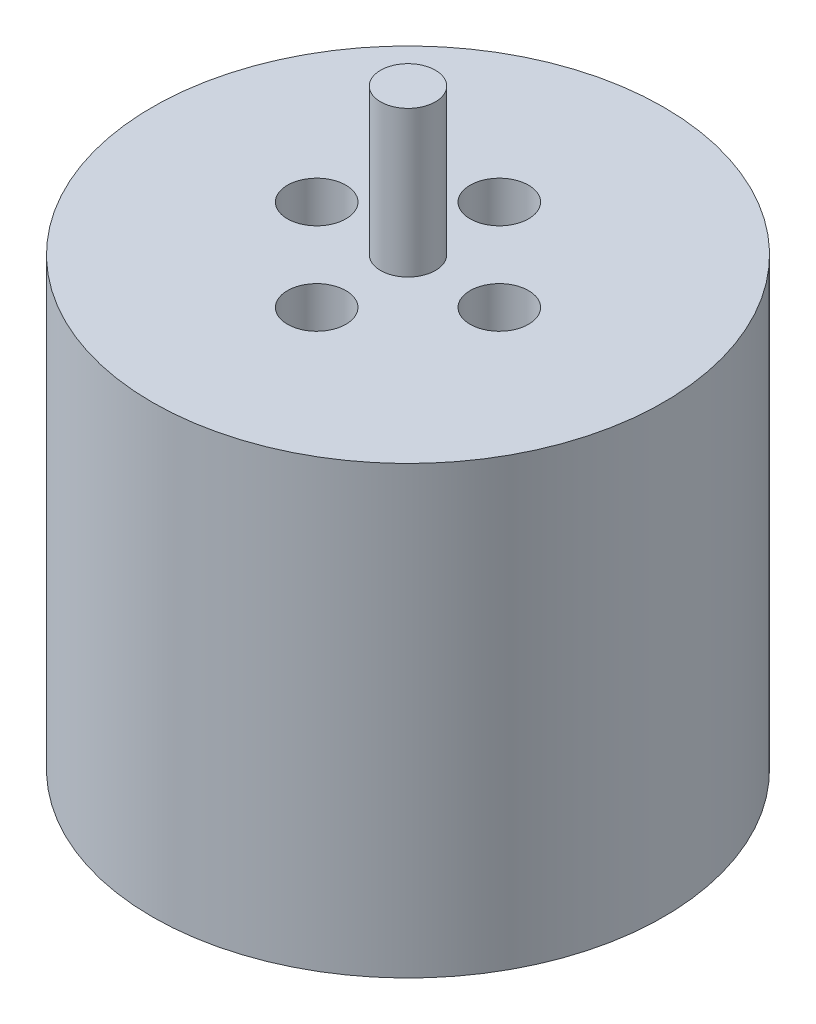
from build123d import *

# Parameters (mm, degrees)
SKETCH1_R           = 7
BOSS_EXTRUDE1_DEPTH = 6.1
SKETCH2_R           = 0.75
BOSS_EXTRUDE2_DEPTH = 1
BOSS_EXTRUDE3_START = 4
SKETCH3_R           = 0.75
BOSS_EXTRUDE3_DEPTH = 4
SKETCH4_R           = 0.8
CUT_EXTRUDE1_DEPTH  = 2
SKETCH5_R           = 0.8
CUT_EXTRUDE2_DEPTH  = 2


with BuildPart() as part:
    # Sketch1 → Boss-Extrude1 (new, symmetric)
    with BuildSketch(Plane(origin=(0, 0, 0), x_dir=(1, 0, 0), z_dir=(0, 1, 0))):
        Circle(SKETCH1_R)
    extrude(amount=BOSS_EXTRUDE1_DEPTH, both=True)

    # Sketch2 → Boss-Extrude2 (add)
    with BuildSketch(Plane.XZ.offset(6.1)):
        Circle(SKETCH2_R)
    extrude(amount=BOSS_EXTRUDE2_DEPTH)

    # Sketch3 → Boss-Extrude3 (add)
    with BuildSketch(Plane(origin=(0, 6.1, 0), x_dir=(1, 0, 0), z_dir=(0, 1, 0)).offset(BOSS_EXTRUDE3_START)):
        Circle(SKETCH3_R)
    extrude(amount=-BOSS_EXTRUDE3_DEPTH)

    # Sketch4 → Cut-Extrude1 (cut)
    with BuildSketch(Plane.XZ.offset(6.1)):
        with Locations((0, 4.5)):
            Circle(SKETCH4_R)
        with Locations((4.5, 0)):
            Circle(SKETCH4_R)
        with Locations((0, -4.5)):
            Circle(SKETCH4_R)
        with Locations((-4.5, 0)):
            Circle(SKETCH4_R)
    extrude(amount=-CUT_EXTRUDE1_DEPTH, mode=Mode.SUBTRACT)

    # Sketch5 → Cut-Extrude2 (cut)
    with BuildSketch(Plane(origin=(0, 6.1, 0), x_dir=(1, 0, 0), z_dir=(0, 1, 0))):
        with Locations((2.5, 0)):
            Circle(SKETCH5_R)
        with Locations((0, -2.5)):
            Circle(SKETCH5_R)
        with Locations((-2.5, 0)):
            Circle(SKETCH5_R)
        with Locations((0, 2.5)):
            Circle(SKETCH5_R)
    extrude(amount=-CUT_EXTRUDE2_DEPTH, mode=Mode.SUBTRACT)


solid = part.part
